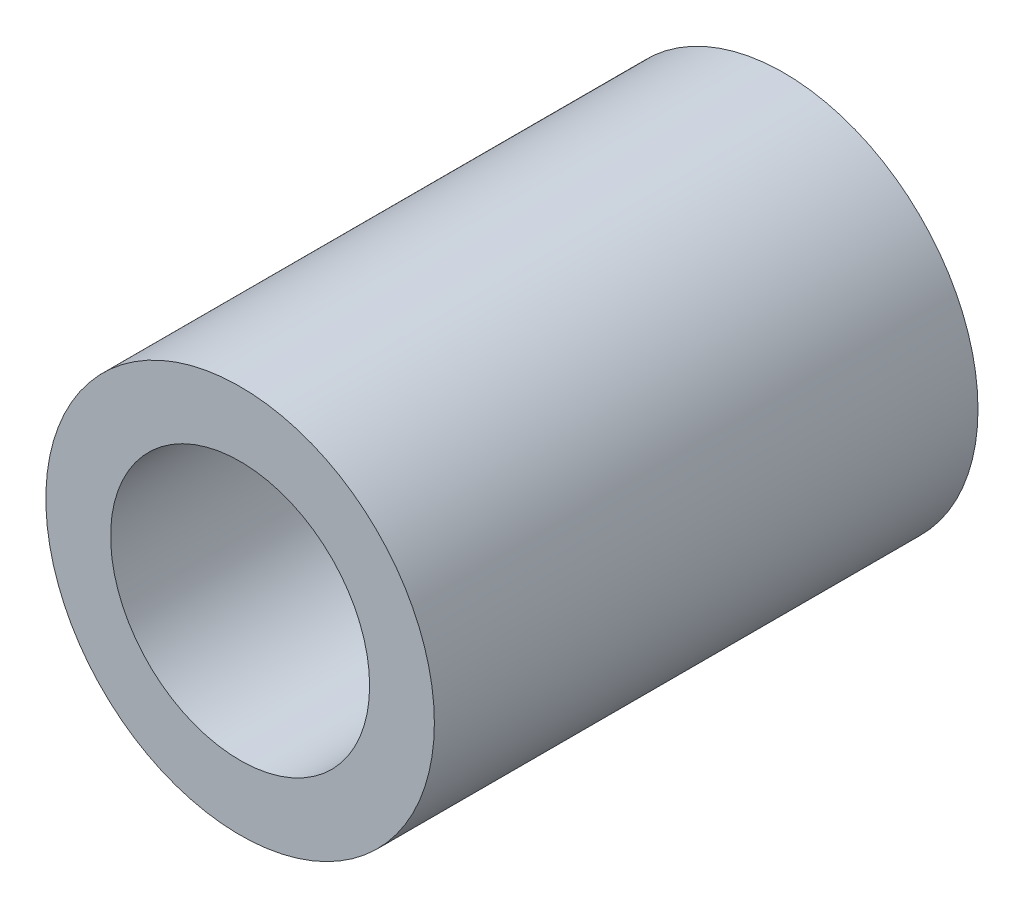
from build123d import *

# Parameters (mm, degrees)
SKETCH1_R           = 4.7625
SKETCH1_R_2         = 3.175
BOSS_EXTRUDE1_DEPTH = 6.663900058


with BuildPart() as part:
    # Sketch1 → Boss-Extrude1 (new, symmetric)
    with BuildSketch(Plane.XY):
        Circle(SKETCH1_R)
        Circle(SKETCH1_R_2, mode=Mode.SUBTRACT)
    extrude(amount=BOSS_EXTRUDE1_DEPTH, both=True)


solid = part.part
